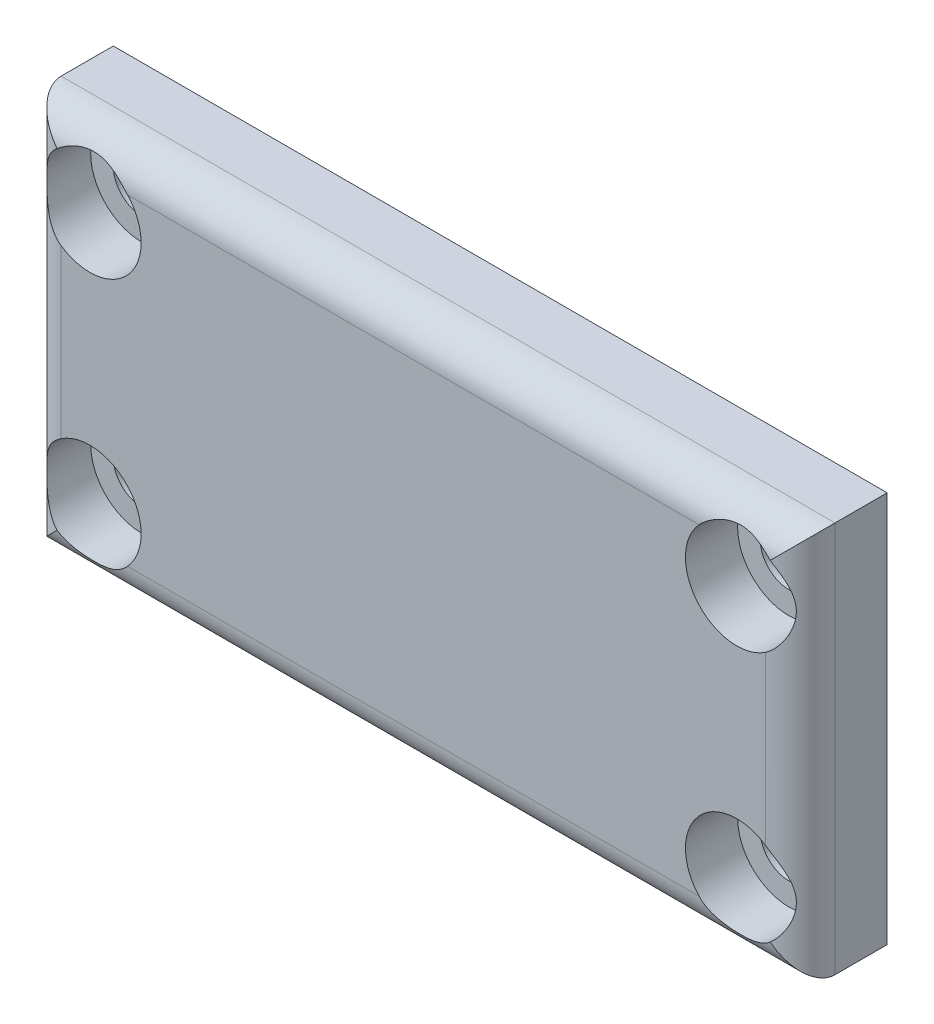
from build123d import *

# Parameters (mm, degrees)
SKIZZE1_W                       = 44.5
SKIZZE1_H                       = 22.5
SKIZZE1_R                       = 1.65
AUFSATZ_LINEAR_AUSTRAGEN1_DEPTH = 5
VERRUNDUNG1_R                   = 2
SKIZZE2_R                       = 2.95
SCHNITT_LINEAR_AUSTRAGEN1_DEPTH = 3


with BuildPart() as part:
    # Skizze1 → Aufsatz-Linear austragen1 (new body)
    with BuildSketch(Plane.XY):
        Rectangle(SKIZZE1_W, SKIZZE1_H)
        with Locations((-18.6, 7.25)):
            Circle(SKIZZE1_R, mode=Mode.SUBTRACT)
        with Locations(Location((18.6, 7.25, 0), (0, 0, 180))):
            Circle(SKIZZE1_R, mode=Mode.SUBTRACT)
        with Locations((18.6, -7.25)):
            Circle(SKIZZE1_R, mode=Mode.SUBTRACT)
        with Locations(Location((-18.6, -7.25, 0), (0, 0, 180))):
            Circle(SKIZZE1_R, mode=Mode.SUBTRACT)
    extrude(amount=AUFSATZ_LINEAR_AUSTRAGEN1_DEPTH)

    # Verrundung1
    verrundung1_edges = [part.edges().sort_by_distance(p)[0] for p in [
        (-22.25, 0, 5),
        (0, -11.25, 5),
        (22.25, 0, 5),
        (0, 11.25, 5),
    ]]
    fillet(verrundung1_edges, radius=VERRUNDUNG1_R - 0.0001)  # a hair under: the kernel refuses the full size

    # Skizze2 → Schnitt-Linear austragen1 (cut)
    with BuildSketch(Plane.XY.offset(5)):
        with Locations(Location((-18.6, 7.25, 0), (0, 0, 42.684910775))):
            Circle(SKIZZE2_R)
        with Locations(Location((-18.6, -7.25, 0), (0, 0, 317.315089225))):
            Circle(SKIZZE2_R)
        with Locations(Location((18.6, -7.25, 0), (0, 0, 310.187569286))):
            Circle(SKIZZE2_R)
        with Locations(Location((18.6, 7.25, 0), (0, 0, 49.812430991))):
            Circle(SKIZZE2_R)
    extrude(amount=-SCHNITT_LINEAR_AUSTRAGEN1_DEPTH, mode=Mode.SUBTRACT)


solid = part.part
